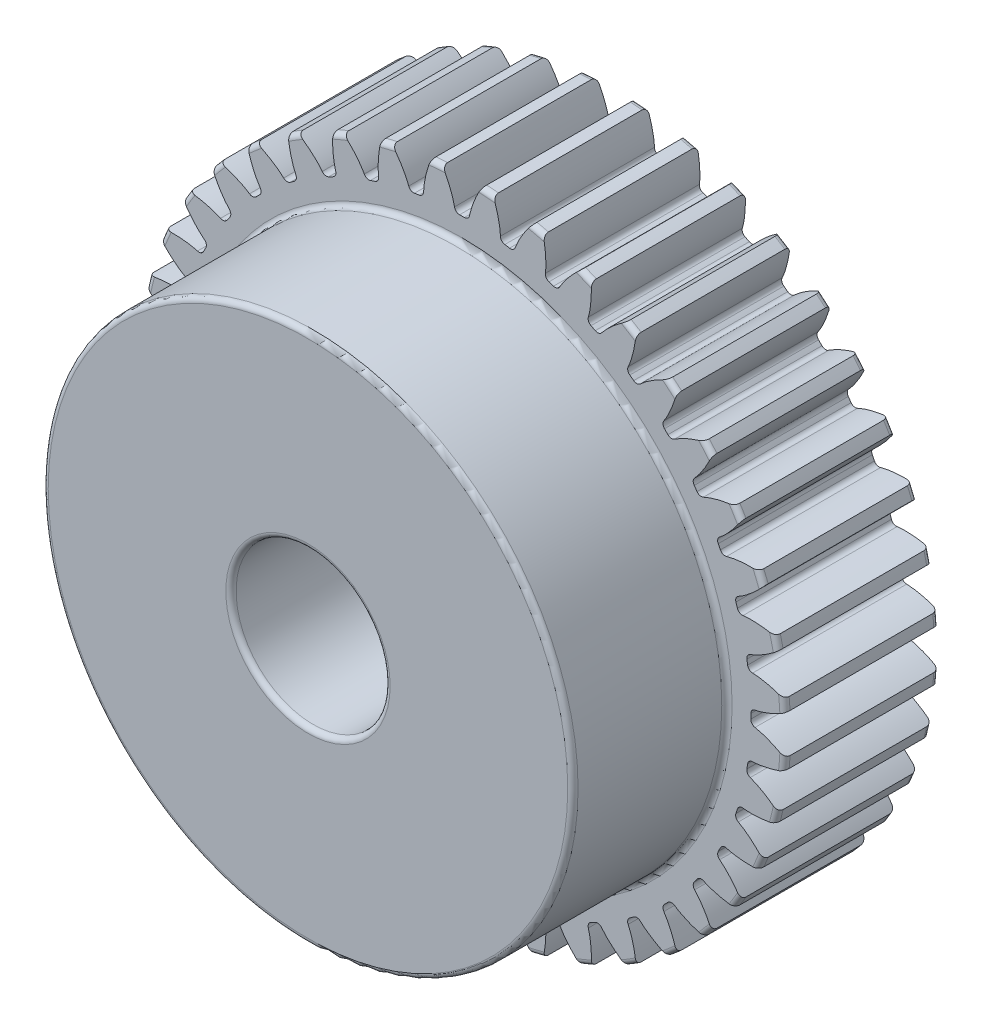
from build123d import *

# Parameters (mm, degrees)
BOSS_EXTRUDE1_DEPTH      = 12.7
BOSS_EXTRUDE1_DEPTH_BACK = 12.7
SKETCH3_R                = 26.67
SKETCH5_W                = 12.7
SKETCH5_H                = 4.826
SKETCH5_W_2              = 25.4
SKETCH5_H_2              = 6.35
FILLET2_R                = 0.426091396
CUT_EXTRUDE1_DEPTH       = 40.797836791
FILLET1_R                = 0.426091396
CIRPATTERN1_COUNT        = 40
FILLET1_OF_CIRPATTERN1_R = 0.426091396


with BuildPart() as part:
    # Sketch3 → Boss-Extrude1 (new, two sides: drawn at the far end of the back side and taken through both)
    with BuildSketch(Plane.XY.offset(-BOSS_EXTRUDE1_DEPTH_BACK)):
        Circle(SKETCH3_R)
    extrude(amount=BOSS_EXTRUDE1_DEPTH + BOSS_EXTRUDE1_DEPTH_BACK)

    # Sketch5 → Cut-Revolve1 (revolve, cut)
    with BuildSketch(Plane(origin=(0, 0, 0), x_dir=(0, 0, -1), z_dir=(1, 0, 0)), mode=Mode.PRIVATE) as cut_revolve1_sk:
        with Locations((-6.35, 24.257)):
            Rectangle(SKETCH5_W, SKETCH5_H)
        with Locations((0, 3.175)):
            Rectangle(SKETCH5_W_2, SKETCH5_H_2)
    revolve(cut_revolve1_sk.sketch.rotate(Axis((0, 0, 12.7), (0, 0, -1)), 90), axis=Axis((0, 0, 12.7), (0, 0, -1)), mode=Mode.SUBTRACT)

    # Fillet2
    fillet2_edges = [part.edges().sort_by_distance(p)[0] for p in [
        (-6.35, 0, 12.7),
        (-6.35, 0, -12.7),
        (-21.844, 0, 12.7),
        (-21.844, 0, 0),
        (-26.67, 0, 0),
        (-26.67, 0, -12.7),
    ]]
    fillet(fillet2_edges, radius=FILLET2_R)

    # Sketch4 → Cut-Extrude1 (cut, symmetric)
    with BuildSketch(Plane.XY):
        with BuildLine():
            Line((23.805431862, 0.58014664), (23.861107899, 0.581503484))
            add(Edge.make_bspline(
                [(23.861107899, 0.581503484), (23.865491394, 0.581656584), (23.877782006, 0.582229225), (23.901001525, 0.583877498), (23.938862615, 0.587370548), (23.98705952, 0.593002454), (24.049296811, 0.601638249), (24.122530739, 0.613556165), (24.202917072, 0.628481684), (24.290260257, 0.646693102), (24.377288642, 0.666606389), (24.463993984, 0.688094976), (24.550261373, 0.710965729), (24.65462588, 0.740400625), (24.779577858, 0.778101916), (24.925325839, 0.825674511), (25.090251782, 0.88376555), (25.257910771, 0.947393641), (25.422524397, 1.013638057), (25.588399373, 1.084747707), (25.748575087, 1.156510249), (25.914462046, 1.235329419), (26.067337555, 1.310259595), (26.238045397, 1.398944077), (26.375644023, 1.471895525), (26.51728997, 1.551202577), (26.586156499, 1.590384455), (26.621320267, 1.610654285)],
                knots=[0, 0, 0, 0, 0, 0.005376749, 0.015083688, 0.02853182, 0.04661014, 0.064854849, 0.092110526, 0.119476176, 0.146842496, 0.174208854, 0.201574956, 0.228941013, 0.256307345, 0.307035032, 0.361767352, 0.416499661, 0.471231937, 0.525964282, 0.580696616, 0.635428982, 0.690161387, 0.744893688, 0.799626082, 0.854358407, 0.909090914, 0.909090914, 0.909090914, 0.909090914, 0.909090914], degree=4))
            ThreePointArc((26.621320267, 1.610654285), (26.67, 0), (26.621320267, -1.610654285))
            add(Edge.make_bspline(
                [(23.861107899, -0.581503484), (23.865491394, -0.581656584), (23.877782006, -0.582229225), (23.901001525, -0.583877498), (23.938862615, -0.587370548), (23.98705952, -0.593002454), (24.049296811, -0.601638249), (24.122530739, -0.613556165), (24.202917072, -0.628481684), (24.290260257, -0.646693102), (24.377288642, -0.666606389), (24.463993984, -0.688094976), (24.550261373, -0.710965729), (24.65462588, -0.740400625), (24.779577858, -0.778101916), (24.925325839, -0.825674511), (25.090251782, -0.88376555), (25.257910771, -0.947393641), (25.422524397, -1.013638057), (25.588399373, -1.084747707), (25.748575087, -1.156510249), (25.914462046, -1.235329419), (26.067337555, -1.310259595), (26.238045397, -1.398944077), (26.375644023, -1.471895525), (26.51728997, -1.551202577), (26.586156499, -1.590384455), (26.621320267, -1.610654285)],
                knots=[0, 0, 0, 0, 0, 0.005376749, 0.015083688, 0.02853182, 0.04661014, 0.064854849, 0.092110526, 0.119476176, 0.146842496, 0.174208854, 0.201574956, 0.228941013, 0.256307345, 0.307035032, 0.361767352, 0.416499661, 0.471231937, 0.525964282, 0.580696616, 0.635428982, 0.690161387, 0.744893688, 0.799626082, 0.854358407, 0.909090914, 0.909090914, 0.909090914, 0.909090914, 0.909090914], degree=4))
            Line((23.861107899, -0.581503484), (23.805431862, -0.58014664))
            ThreePointArc((23.805431862, -0.58014664), (23.8125, 0), (23.805431862, 0.58014664))
        make_face()
    cut_extrude1 = extrude(amount=CUT_EXTRUDE1_DEPTH, both=True, mode=Mode.SUBTRACT)

    # Fillet1
    fillet1_edges = [part.edges().sort_by_distance(p)[0] for p in [
        (23.805431862, -0.58014664, -6.35),
        (23.805431862, 0.58014664, -6.35),
    ]]
    fillet(fillet1_edges, radius=FILLET1_R)

    # CirPattern1: Cut-Extrude1 ×40 about axis
    cirpattern1_axis = Axis((0, 0, 12.7), (0, 0, -1))
    for i in range(1, CIRPATTERN1_COUNT):
        add(cut_extrude1.rotate(cirpattern1_axis, i * 360 / CIRPATTERN1_COUNT), mode=Mode.SUBTRACT)

    # Fillet1 of CirPattern1
    fillet1_of_cirpattern1_edges = [part.edges().sort_by_distance(p)[0] for p in [
        (23.421592563, -4.296994071, -6.35),
        (23.603102422, -3.150985926, -6.35),
        (22.461035924, -7.908035246, -6.35),
        (22.819586266, -6.804530761, -6.35),
        (20.947414037, -11.324354349, -6.35),
        (21.474176163, -10.290525466, -6.35),
        (18.917997295, -14.461830264, -6.35),
        (19.600000574, -13.523133282, -6.35),
        (16.422756675, -17.243207922, -6.35),
        (17.243207922, -16.422756675, -6.35),
        (13.523133282, -19.600000574, -6.35),
        (14.461830264, -18.917997295, -6.35),
        (10.290525466, -21.474176163, -6.35),
        (11.324354349, -20.947414037, -6.35),
        (6.804530761, -22.819586266, -6.35),
        (7.908035246, -22.461035924, -6.35),
        (3.150985926, -23.603102422, -6.35),
        (4.296994071, -23.421592563, -6.35),
        (-0.58014664, -23.805431862, -6.35),
        (0.58014664, -23.805431862, -6.35),
        (-4.296994071, -23.421592563, -6.35),
        (-3.150985926, -23.603102422, -6.35),
        (-7.908035246, -22.461035924, -6.35),
        (-6.804530761, -22.819586266, -6.35),
        (-11.324354349, -20.947414037, -6.35),
        (-10.290525466, -21.474176163, -6.35),
        (-14.461830264, -18.917997295, -6.35),
        (-13.523133282, -19.600000574, -6.35),
        (-17.243207922, -16.422756675, -6.35),
        (-16.422756675, -17.243207922, -6.35),
        (-19.600000574, -13.523133282, -6.35),
        (-18.917997295, -14.461830264, -6.35),
        (-21.474176163, -10.290525466, -6.35),
        (-20.947414037, -11.324354349, -6.35),
        (-22.819586266, -6.804530761, -6.35),
        (-22.461035924, -7.908035246, -6.35),
        (-23.603102422, -3.150985926, -6.35),
        (-23.421592563, -4.296994071, -6.35),
        (-23.805431862, 0.58014664, -6.35),
        (-23.805431862, -0.58014664, -6.35),
        (-23.421592563, 4.296994071, -6.35),
        (-23.603102422, 3.150985926, -6.35),
        (-22.461035924, 7.908035246, -6.35),
        (-22.819586266, 6.804530761, -6.35),
        (-20.947414037, 11.324354349, -6.35),
        (-21.474176163, 10.290525466, -6.35),
        (-18.917997295, 14.461830264, -6.35),
        (-19.600000574, 13.523133282, -6.35),
        (-16.422756675, 17.243207922, -6.35),
        (-17.243207922, 16.422756675, -6.35),
        (-13.523133282, 19.600000574, -6.35),
        (-14.461830264, 18.917997295, -6.35),
        (-10.290525466, 21.474176163, -6.35),
        (-11.324354349, 20.947414037, -6.35),
        (-6.804530761, 22.819586266, -6.35),
        (-7.908035246, 22.461035924, -6.35),
        (-3.150985926, 23.603102422, -6.35),
        (-4.296994071, 23.421592563, -6.35),
        (0.58014664, 23.805431862, -6.35),
        (-0.58014664, 23.805431862, -6.35),
        (4.296994071, 23.421592563, -6.35),
        (3.150985926, 23.603102422, -6.35),
        (7.908035246, 22.461035924, -6.35),
        (6.804530761, 22.819586266, -6.35),
        (11.324354349, 20.947414037, -6.35),
        (10.290525466, 21.474176163, -6.35),
        (14.461830264, 18.917997295, -6.35),
        (13.523133282, 19.600000574, -6.35),
        (17.243207922, 16.422756675, -6.35),
        (16.422756675, 17.243207922, -6.35),
        (19.600000574, 13.523133282, -6.35),
        (18.917997295, 14.461830264, -6.35),
        (21.474176163, 10.290525466, -6.35),
        (20.947414037, 11.324354349, -6.35),
        (22.819586266, 6.804530761, -6.35),
        (22.461035924, 7.908035246, -6.35),
        (23.603102422, 3.150985926, -6.35),
        (23.421592563, 4.296994071, -6.35),
    ]]
    fillet(fillet1_of_cirpattern1_edges, radius=FILLET1_OF_CIRPATTERN1_R)


solid = part.part
